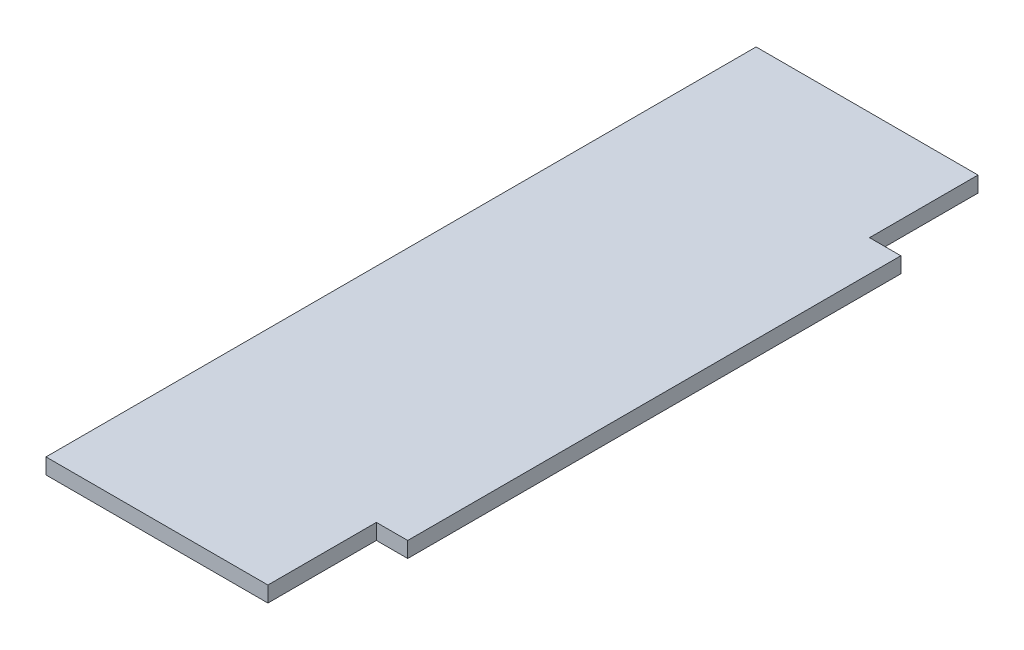
from build123d import *

# Parameters (mm, degrees)
BOSS_EXTRUDE1_DEPTH = 3.175


with BuildPart() as part:
    # Sketch1 → Boss-Extrude1 (new body)
    with BuildSketch(Plane(origin=(0, 0, 0), x_dir=(1, 0, 0), z_dir=(0, 1, 0))):
        Polygon((22.5, 22), (-22.5, 22), (-22.5, 0), (-22.5, -100), (-22.5, -122), (22.5, -122), (22.5, -100), (28.85, -100), (28.85, 0), (22.5, 0), align=None)
    extrude(amount=BOSS_EXTRUDE1_DEPTH)


solid = part.part
